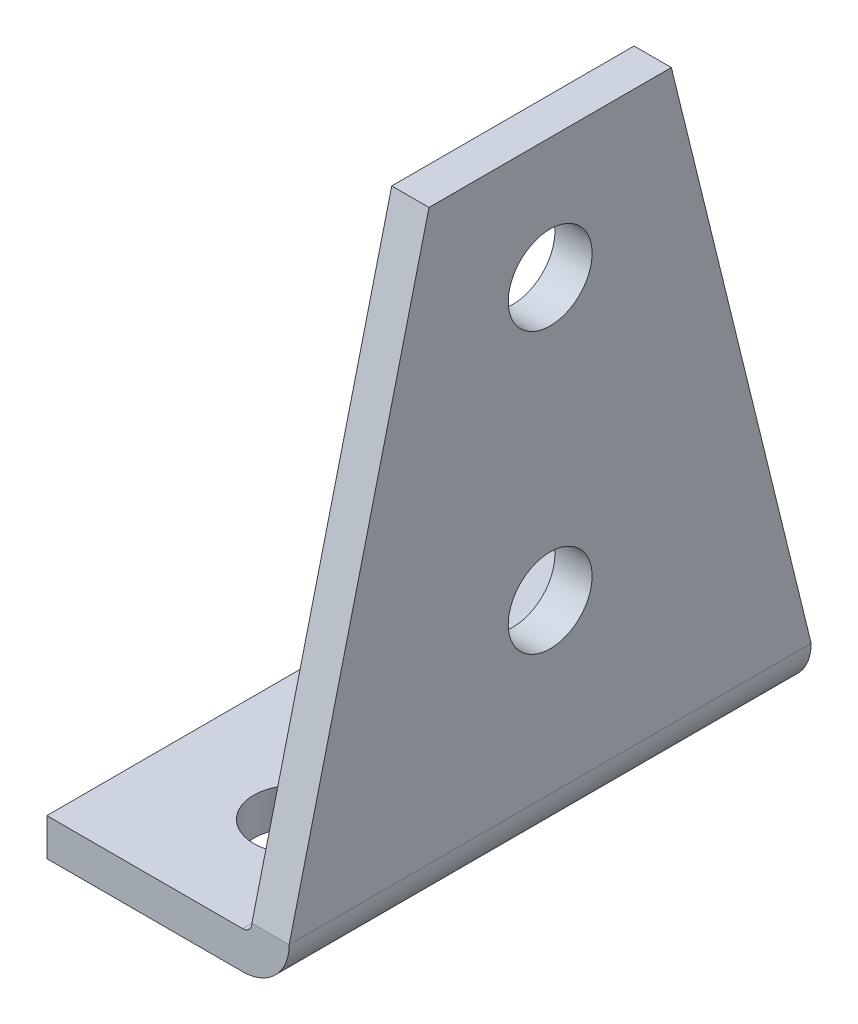
from build123d import *

# Parameters (mm, degrees)
EXTRUDE_THIN1_DEPTH     = 44.45
CUT_EXTRUDE2_DEPTH      = 120.051916196
CUT_EXTRUDE2_DEPTH_BACK = 120.051916196
SKETCH3_R               = 7.14375
CUT_EXTRUDE3_DEPTH      = 120.051916196
SKETCH4_R               = 7.14375
CUT_EXTRUDE4_DEPTH      = 116.615348246


with BuildPart() as part:
    # Sketch1 → Extrude-Thin1 (new, symmetric)
    with BuildSketch(Plane.XY):
        with BuildLine():
            Line((-41.275, 0), (-7.9375, 0))
            ThreePointArc((-7.9375, 0), (-2.324839924, 2.324839924), (0, 7.9375))
            Line((0, 7.9375), (0, 104.775))
            Line((0, 104.775), (-6.35, 104.775))
            Line((-6.35, 104.775), (-6.35, 7.9375))
            ThreePointArc((-6.35, 7.9375), (-6.814967985, 6.814967985), (-7.9375, 6.35))
            Line((-7.9375, 6.35), (-41.275, 6.35))
            Line((-41.275, 6.35), (-41.275, 0))
        make_face()
    extrude(amount=EXTRUDE_THIN1_DEPTH, both=True)

    # Sketch2 → Cut-Extrude2 (cut, two sides: drawn at the far end of the back side and taken through both)
    with BuildSketch(Plane.ZY.offset(6.35).offset(-CUT_EXTRUDE2_DEPTH_BACK)):
        Polygon((-109.618200913, -257.07985038), (-44.45, 7.9375), (-20.6375, 104.775), (20.6375, 104.775), (44.45, 7.9375), (109.618200913, -257.07985038), (109.618200913, 288.744628415), (-109.618200913, 288.744628415), align=None)
    extrude(amount=CUT_EXTRUDE2_DEPTH + CUT_EXTRUDE2_DEPTH_BACK, mode=Mode.SUBTRACT)

    # Sketch3 → Cut-Extrude3 (cut, through all)
    with BuildSketch(Plane.ZY.offset(6.35)):
        with Locations((0, 84.1375)):
            Circle(SKETCH3_R)
        with Locations((0, 36.5125)):
            Circle(SKETCH3_R)
    extrude(amount=-CUT_EXTRUDE3_DEPTH, mode=Mode.SUBTRACT)

    # Sketch4 → Cut-Extrude4 (cut, through all)
    with BuildSketch(Plane(origin=(0, 6.35, 0), x_dir=(1, 0, 0), z_dir=(0, 1, 0))):
        with Locations((-19.52625, 23.8125)):
            Circle(SKETCH4_R)
        with Locations((-19.52625, -23.8125)):
            Circle(SKETCH4_R)
    extrude(amount=-CUT_EXTRUDE4_DEPTH, mode=Mode.SUBTRACT)


solid = part.part
